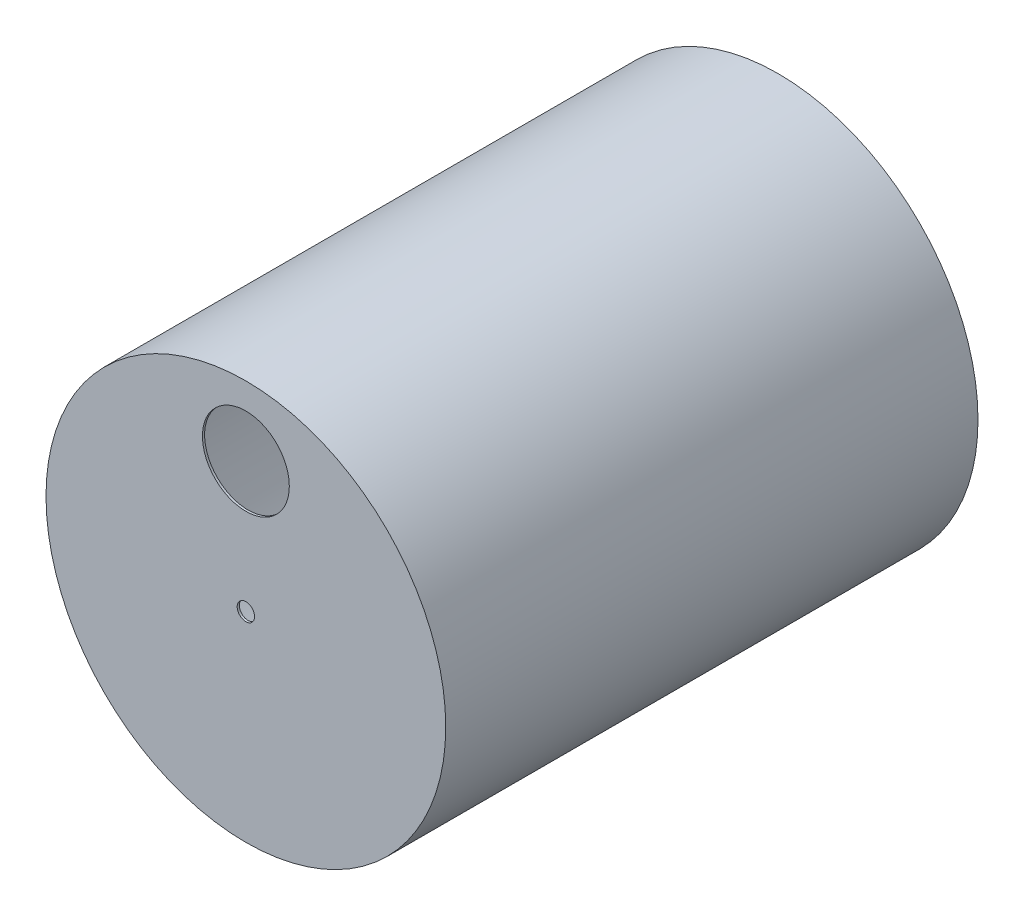
from build123d import *

# Parameters (mm, degrees)
SKETCH1_R           = 92
SKETCH1_R_2         = 90
BOSS_EXTRUDE1_DEPTH = 245
BOSS_EXTRUDE2_START = -1
SKETCH2_R           = 90
SKETCH2_R_2         = 4
SKETCH2_R_3         = 20
BOSS_EXTRUDE2_DEPTH = 1


with BuildPart() as part:
    # Sketch1 → Boss-Extrude1 (new body)
    with BuildSketch(Plane.XY):
        Circle(SKETCH1_R)
        Circle(SKETCH1_R_2, mode=Mode.SUBTRACT)
    extrude(amount=BOSS_EXTRUDE1_DEPTH)

    # Sketch2 → Boss-Extrude2 (add)
    with BuildSketch(Plane.XY.offset(245).offset(BOSS_EXTRUDE2_START)):
        Circle(SKETCH2_R)
        Circle(SKETCH2_R_2, mode=Mode.SUBTRACT)
        with Locations((0, 60)):
            Circle(SKETCH2_R_3, mode=Mode.SUBTRACT)
    extrude(amount=BOSS_EXTRUDE2_DEPTH)


solid = part.part
